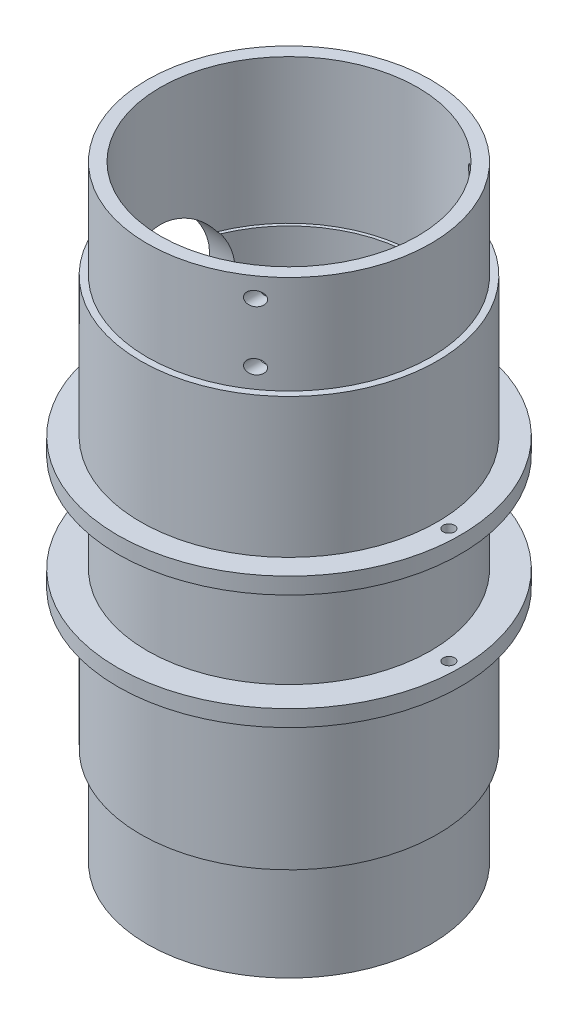
from build123d import *

# Parameters (mm, degrees)
SKETCH1_R                      = 45.25
SKETCH1_R_2                    = 38.25
BOSS_EXTRUDE1_DEPTH            = 92.5
BOSS_EXTRUDE2_START            = -6.35
SKETCH2_R                      = 38.25
SKETCH2_R_2                    = 36.25
BOSS_EXTRUDE2_DEPTH            = 100
CUT_EXTRUDE3_START             = -44
SKETCH6_R                      = 39.25
SKETCH6_R_2                    = 38.25
CUT_EXTRUDE3_DEPTH             = 44
SKETCH7_R                      = 17.5
CUT_EXTRUDE4_DEPTH             = 113.478331247
SKETCH8_R                      = 45.25
SKETCH8_R_2                    = 43.25
CUT_EXTRUDE5_DEPTH             = 30
SKETCH9_R                      = 45.25
SKETCH9_R_2                    = 43.25
CUT_EXTRUDE6_DEPTH             = 15
SKETCH10_R                     = 52.25
SKETCH10_R_2                   = 43.25
SKETCH10_R_3                   = 1.75
BOSS_EXTRUDE3_DEPTH            = 5
CBORE_FOR_M4_SHCS1_D           = 4.3
CBORE_FOR_M4_SHCS1_DEPTH       = 100.101198794
CBORE_FOR_M4_SHCS1_CBORE_D     = 8
CBORE_FOR_M4_SHCS1_CBORE_DEPTH = 4
CBORE_FOR_M4_SHCS1_TIP         = 1.291850331


with BuildPart() as part:
    # Sketch1 → Boss-Extrude1 (new, symmetric)
    with BuildSketch(Plane(origin=(0, 0, 0), x_dir=(1, 0, 0), z_dir=(0, 1, 0))):
        Circle(SKETCH1_R)
        Circle(SKETCH1_R_2, mode=Mode.SUBTRACT)
    extrude(amount=BOSS_EXTRUDE1_DEPTH, both=True)

    # Sketch2 → Boss-Extrude2 (add)
    with BuildSketch(Plane.XZ.offset(92.5).offset(BOSS_EXTRUDE2_START)):
        Circle(SKETCH2_R)
        Circle(SKETCH2_R_2, mode=Mode.SUBTRACT)
    extrude(amount=-BOSS_EXTRUDE2_DEPTH)

    # Sketch6 → Cut-Extrude3 (cut)
    with BuildSketch(Plane(origin=(0, 92.5, 0), x_dir=(1, 0, 0), z_dir=(0, 1, 0)).offset(CUT_EXTRUDE3_START)):
        Circle(SKETCH6_R)
        Circle(SKETCH6_R_2, mode=Mode.SUBTRACT)
    extrude(amount=CUT_EXTRUDE3_DEPTH, mode=Mode.SUBTRACT)

    # Sketch7 → Cut-Extrude4 (cut, through all)
    with BuildSketch(Plane(origin=(0, 0, 0), x_dir=(0, 0, -1), z_dir=(1, 0, 0))):
        with Locations((0, 38.75)):
            Circle(SKETCH7_R)
    extrude(amount=-CUT_EXTRUDE4_DEPTH, mode=Mode.SUBTRACT)

    # Sketch8 → Cut-Extrude5 (cut)
    with BuildSketch(Plane(origin=(0, 92.5, 0), x_dir=(1, 0, 0), z_dir=(0, 1, 0))):
        Circle(SKETCH8_R)
        Circle(SKETCH8_R_2, mode=Mode.SUBTRACT)
    cut_extrude5 = extrude(amount=-CUT_EXTRUDE5_DEPTH, mode=Mode.SUBTRACT)

    # Mirror1: Cut-Extrude5 across plane
    add(cut_extrude5.mirror(Plane.ZX), mode=Mode.SUBTRACT)

    # Sketch9 → Cut-Extrude6 (cut, symmetric)
    with BuildSketch(Plane(origin=(0, 0, 0), x_dir=(1, 0, 0), z_dir=(0, 1, 0))):
        Circle(SKETCH9_R)
        Circle(SKETCH9_R_2, mode=Mode.SUBTRACT)
    extrude(amount=CUT_EXTRUDE6_DEPTH, both=True, mode=Mode.SUBTRACT)

    # Sketch10 → Boss-Extrude3 (add)
    with BuildSketch(Plane(origin=(0, 15, 0), x_dir=(-1, 0, 0), z_dir=(0, -1, 0))):
        Circle(SKETCH10_R)
        Circle(SKETCH10_R_2, mode=Mode.SUBTRACT)
        with Locations((-48.75, 0)):
            Circle(SKETCH10_R_3, mode=Mode.SUBTRACT)
    boss_extrude3 = extrude(amount=-BOSS_EXTRUDE3_DEPTH)

    # Mirror2: Boss-Extrude3 across plane
    add(boss_extrude3.mirror(Plane.ZX))

    # CBORE for M4 SHCS1
    with Locations(Plane(origin=(401.677021233, -407.224238547, 50.050599397), x_dir=(0.16757219303491572, 0.985859807539322, 0), z_dir=(0, 0, 1))):
        with Locations((405.876811742, 451.068889591), (423.622288278, 454.085189065)):
            CounterBoreHole(CBORE_FOR_M4_SHCS1_D / 2, CBORE_FOR_M4_SHCS1_CBORE_D / 2, CBORE_FOR_M4_SHCS1_CBORE_DEPTH, depth=CBORE_FOR_M4_SHCS1_DEPTH)
            with Locations((0, 0, -(CBORE_FOR_M4_SHCS1_DEPTH + CBORE_FOR_M4_SHCS1_TIP / 2))):  # 118° drill point
                Cone(0, CBORE_FOR_M4_SHCS1_D / 2, CBORE_FOR_M4_SHCS1_TIP, mode=Mode.SUBTRACT)


solid = part.part
